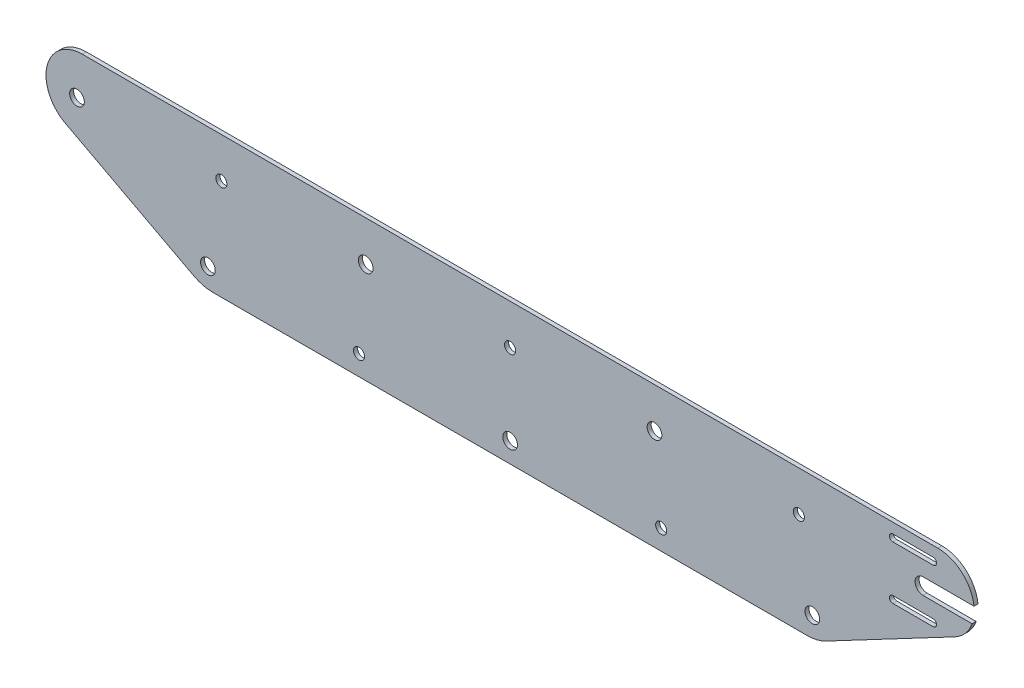
from build123d import *

# Parameters (mm, degrees)
ESQUISSE1_R             = 3.65
BOSS_EXTRU_1_DEPTH      = 2
CONG_1_R                = 18
CONG_2_R                = 20
D_GAGEMENT_M31_D        = 3.4
ENL_V_MAT_EXTRU_1_DEPTH = 234.819122898
D_GAGEMENT_M51_D        = 5.5
D_GAGEMENT_M52_D        = 5.5


with BuildPart() as part:
    # Esquisse1 → Boss.-Extru.1 (new body)
    with BuildSketch(Plane.XY):
        Polygon((-284.958991582, 40), (-150, 40), (150, 40), (284.958991582, 40), (152.479495791, -30), (-152.479495791, -30), align=None)
        with Locations((-215, 20)):
            Circle(ESQUISSE1_R, mode=Mode.SUBTRACT)
        with Locations((-150, -20)):
            Circle(ESQUISSE1_R, mode=Mode.SUBTRACT)
        with Locations((150, -20)):
            Circle(ESQUISSE1_R, mode=Mode.SUBTRACT)
        with Locations((215, 20)):
            Circle(ESQUISSE1_R, mode=Mode.SUBTRACT)
        with Locations((0, -20)):
            Circle(ESQUISSE1_R, mode=Mode.SUBTRACT)
        with Locations((-71.666666667, 20)):
            Circle(ESQUISSE1_R, mode=Mode.SUBTRACT)
        with Locations((71.666666667, 20)):
            Circle(ESQUISSE1_R, mode=Mode.SUBTRACT)
    extrude(amount=BOSS_EXTRU_1_DEPTH)

    # Congé1
    cong_1_edges = [part.edges().sort_by_distance(p)[0] for p in [
        (-284.958991582, 40, 1),
        (284.958991582, 40, 1),
    ]]
    fillet(cong_1_edges, radius=CONG_1_R)

    # Congé2
    cong_2_edges = [part.edges().sort_by_distance(p)[0] for p in [
        (-152.479495791, -30, 1),
        (152.479495791, -30, 1),
    ]]
    fillet(cong_2_edges, radius=CONG_2_R)

    # Dégagement M31 (through all)
    with Locations(Plane(origin=(0, 0, 0), x_dir=(-1, 0, 0), z_dir=(0, 0, -1))):
        with Locations((-200, 33.228756555), (-200, 6.771243445)):
            Hole(D_GAGEMENT_M31_D / 2)

    # Esquisse4 → Enlèv. mat.-Extru.1 (cut, through all)
    with BuildSketch(Plane(origin=(0, 0, 0), x_dir=(-1, 0, 0), z_dir=(0, 0, -1))):
        with BuildLine():
            Line((-229.334149786, 16), (-205, 16))
            ThreePointArc((-205, 16), (-201, 20), (-205, 24))
            Line((-205, 24), (-230.252130857, 24))
            ThreePointArc((-230.252130857, 24), (-230.246241418, 19.948007721), (-229.334149786, 16))
        make_face()
        with BuildLine():
            Line((-210, 31.528756555), (-190, 31.528756555))
            ThreePointArc((-190, 31.528756555), (-188.3, 33.228756555), (-190, 34.928756555))
            Line((-190, 34.928756555), (-210, 34.928756555))
            ThreePointArc((-210, 34.928756555), (-211.7, 33.228756555), (-210, 31.528756555))
        make_face()
        with BuildLine():
            Line((-210, 5.071243445), (-190, 5.071243445))
            ThreePointArc((-190, 5.071243445), (-188.3, 6.771243445), (-190, 8.471243445))
            Line((-190, 8.471243445), (-210, 8.471243445))
            ThreePointArc((-210, 8.471243445), (-211.7, 6.771243445), (-210, 5.071243445))
        make_face()
    extrude(amount=-ENL_V_MAT_EXTRU_1_DEPTH, mode=Mode.SUBTRACT)

    # Dégagement M51 (through all)
    with Locations(Plane(origin=(0, 0, 0), x_dir=(-1, 0, 0), z_dir=(0, 0, -1))):
        with Locations((143.333333333, 20), (0, 20), (-143.333333333, 20)):
            Hole(D_GAGEMENT_M51_D / 2)

    # Dégagement M52 (through all)
    with Locations(Plane.XY.offset(2)):
        with Locations((-75, -20), (75, -20)):
            Hole(D_GAGEMENT_M52_D / 2)


solid = part.part
